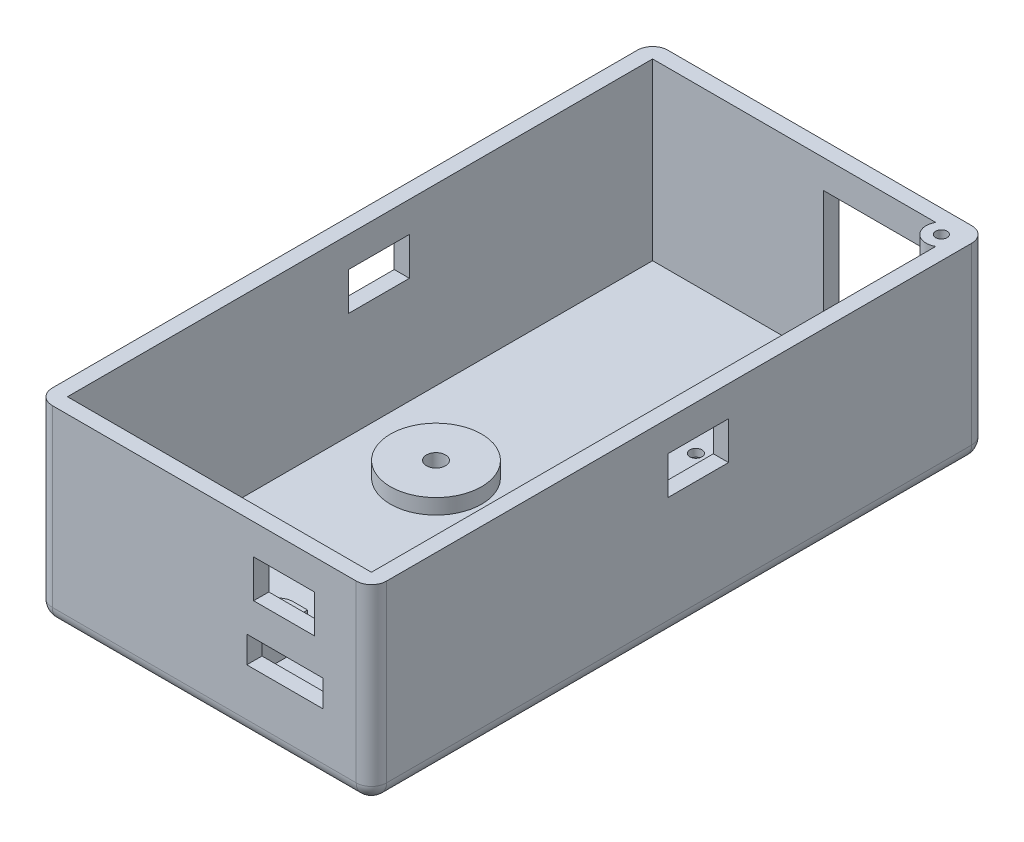
from build123d import *
from build123d.topology import SkipClean

# Parameters (mm, degrees)
SKETCH_1_W           = 44
SKETCH_1_H           = 81
EXTRUDE_1_DEPTH      = 25
SHELL_1_T            = -2
FILLET_1_R           = 2
SKETCH_2_R           = 0.8
SKETCH_2_R_2         = 0.9
CUT_EXTRUDE_1_DEPTH  = 24
SKETCH_3_R           = 1.25
CUT_EXTRUDE_2_DEPTH  = 24
SKETCH_4_R           = 6
EXTRUDE_2_DEPTH      = 2
CUT_EXTRUDE_START    = -13.2
SKETCH_6_R           = 1.25
CUT_EXTRUDE_4_DEPTH  = 13.2
SKETCH_7_W           = 15.5
SKETCH_7_H           = 17.5
CUT_EXTRUDE_5_DEPTH  = 13.2
SKETCH_9_W           = 18.8
SKETCH_9_H           = 6.5
SKETCH_9_R           = 0.9
EXTRUDE_3_DEPTH      = 8
SKETCH_11_W          = 11
SKETCH_11_H          = 6.5
CUT_EXTRUDE_6_DEPTH  = 4
SKETCH_12_W          = 10
SKETCH_12_H          = 3.5
CUT_EXTRUDE_7_DEPTH  = 4
FILLET_2_R           = 2
EXTRUDE_START        = -1
SKETCH_14_R          = 1.25
EXTRUDE_4_DEPTH      = 1
SKETCH_15_R          = 2
CUT_EXTRUDE_8_DEPTH  = 1
SKETCH_16_W          = 8
SKETCH_16_H          = 5
CUT_EXTRUDE_9_DEPTH  = 59
SKETCH_17_R          = 2
EXTRUDE_5_DEPTH      = 3
SKETCH_18_R          = 0.75
CUT_EXTRUDE_10_DEPTH = 3
FILLET_3_R           = 2
SKETCH_19_W          = 8
SKETCH_19_H          = 5
CUT_EXTRUDE_11_DEPTH = 3


with BuildPart() as part:
    # 草图1 → 凸台-拉伸1 (new body)
    with BuildSketch(Plane(origin=(0, 0, 0), x_dir=(1, 0, 0), z_dir=(0, 1, 0))):
        with Locations((0, -2.5)):
            Rectangle(SKETCH_1_W, SKETCH_1_H)
    extrude(amount=EXTRUDE_1_DEPTH)

    # 抽壳1
    shell_1_openings = [part.faces().sort_by_distance(p)[0] for p in [
        (0, 25, 2.5),
    ]]
    offset(amount=SHELL_1_T, openings=shell_1_openings, kind=Kind.INTERSECTION)

    # 圆角1
    fillet_1_edges = [part.edges().sort_by_distance(p)[0] for p in [
        (0, 0, -38),
        (22, 0, 2.5),
        (0, 0, 43),
        (-22, 0, 2.5),
        (-22, 12.5, -38),
        (22, 12.5, -38),
        (22, 12.5, 43),
        (-22, 12.5, 43),
    ]]
    fillet(fillet_1_edges, radius=FILLET_1_R)

    # 草图2 → 切除-拉伸1 (cut)
    with BuildSketch(Plane(origin=(0, 2, 0), x_dir=(1, 0, 0), z_dir=(0, 1, 0))):
        with Locations(Location((4.8, 16.9, 0), (0, 0, 270))):
            Circle(SKETCH_2_R)
        with Locations(Location((16.1, -9.5, 0), (0, 0, 270))):
            Circle(SKETCH_2_R_2)
    extrude(amount=-CUT_EXTRUDE_1_DEPTH, mode=Mode.SUBTRACT)

    # 草图3 → 切除-拉伸2 (cut)
    with BuildSketch(Plane(origin=(0, 2, 0), x_dir=(1, 0, 0), z_dir=(0, 1, 0))):
        with Locations(Location((-9.5, -3, 0), (0, 0, 270))):
            Circle(SKETCH_3_R)
    extrude(amount=-CUT_EXTRUDE_2_DEPTH, mode=Mode.SUBTRACT)

    # 草图4 → 凸台-拉伸2 (add)
    with BuildSketch(Plane(origin=(0, 2, 0), x_dir=(1, 0, 0), z_dir=(0, 1, 0))):
        with Locations(Location((-9.5, -3, 0), (0, 0, 270))):
            Circle(SKETCH_4_R)
    extrude(amount=EXTRUDE_2_DEPTH)

    # 草图6 → 切除-拉伸4 (cut)
    with BuildSketch(Plane.XZ.offset(CUT_EXTRUDE_START)):
        with Locations(Location((-9.5, 3, 0), (0, 0, 90))):
            Circle(SKETCH_6_R)
    extrude(amount=CUT_EXTRUDE_4_DEPTH, mode=Mode.SUBTRACT)

    # 草图7 → 切除-拉伸5 (cut)
    with BuildSketch(Plane(origin=(0, 0, -38), x_dir=(-1, 0, 0), z_dir=(0, 0, -1))):
        with Locations((-10.25, 12.5)):
            Rectangle(SKETCH_7_W, SKETCH_7_H)
    extrude(amount=-CUT_EXTRUDE_5_DEPTH, mode=Mode.SUBTRACT)

    # 草图9 → 凸台-拉伸3 (add)
    with BuildSketch(Plane(origin=(0, 2, 0), x_dir=(1, 0, 0), z_dir=(0, 1, 0))):
        with Locations((10.6, -37.75)):
            Rectangle(SKETCH_9_W, SKETCH_9_H)
        with Locations(Location((18.1, -37.9, 0), (0, 0, 270))):
            Circle(SKETCH_9_R, mode=Mode.SUBTRACT)
        with Locations(Location((3.1, -37.9, 0), (0, 0, 270))):
            Circle(SKETCH_9_R, mode=Mode.SUBTRACT)
    extrude(amount=EXTRUDE_3_DEPTH)

    # 草图11 → 切除-拉伸6 (cut)
    with BuildSketch(Plane(origin=(0, 10, 0), x_dir=(1, 0, 0), z_dir=(0, 1, 0))):
        with Locations((10.6, -37.75)):
            Rectangle(SKETCH_11_W, SKETCH_11_H)
    extrude(amount=-CUT_EXTRUDE_6_DEPTH, mode=Mode.SUBTRACT)

    # 草图12 → 切除-拉伸7 (cut)
    with BuildSketch(Plane.XY.offset(43)):
        with Locations((10.6, 10)):
            Rectangle(SKETCH_12_W, SKETCH_12_H)
    extrude(amount=-CUT_EXTRUDE_7_DEPTH, mode=Mode.SUBTRACT)

    # 圆角2
    fillet_2_edges = [part.edges().sort_by_distance(p)[0] for p in [
        (10.6, 2, 34.5),
        (1.2, 2, 37.75),
        (1.2, 6, 34.5),
    ]]
    fillet(fillet_2_edges, radius=FILLET_2_R)

    # 草图14 → 凸台-拉伸4 (add)
    with BuildSketch(Plane.XZ.offset(EXTRUDE_START)):
        with Locations(Location((-9.5, 3, 0), (0, 0, 90))):
            Circle(SKETCH_14_R)
    extrude(amount=EXTRUDE_4_DEPTH)

    # 草图15 → 切除-拉伸8 (cut)
    with BuildSketch(Plane.XZ):
        with Locations(Location((16.1, 9.5, 0), (0, 0, 270))):
            Circle(SKETCH_15_R)
        with Locations(Location((4.8, -16.9, 0), (0, 0, 270))):
            Circle(SKETCH_15_R)
    extrude(amount=-CUT_EXTRUDE_8_DEPTH, mode=Mode.SUBTRACT)

    # 草图16 → 切除-拉伸9 (cut)
    with BuildSketch(Plane.ZY.offset(22)):
        with Locations((0, 18.5)):
            Rectangle(SKETCH_16_W, SKETCH_16_H)
    extrude(amount=-CUT_EXTRUDE_9_DEPTH, mode=Mode.SUBTRACT)

    # 草图17 → 凸台-拉伸5 (add)
    with BuildSketch(Plane(origin=(0, 25, 0), x_dir=(1, 0, 0), z_dir=(0, 1, 0))):
        with Locations((19, 35)):
            Circle(SKETCH_17_R)
    extrude(amount=-EXTRUDE_5_DEPTH)

    # 草图18 → 切除-拉伸10 (cut)
    with BuildSketch(Plane(origin=(0, 25, 0), x_dir=(1, 0, 0), z_dir=(0, 1, 0))):
        with Locations(Location((19, 35, 0), (0, 0, 270))):
            Circle(SKETCH_18_R)
    extrude(amount=-CUT_EXTRUDE_10_DEPTH, mode=Mode.SUBTRACT)

    # 圆角3
    # the kernel refuses this fillet: 2 mm, written as the material it adds along each edge
    with BuildSketch(Plane(origin=(12.267949192, 22, -36), x_dir=(0, -1, 0), z_dir=(1, 0, 0))) as fillet_3_piece_1_section:
        with BuildLine():
            CenterArc((FILLET_3_R, -FILLET_3_R), FILLET_3_R, 90, 90)
            Line((0, -FILLET_3_R), (0, 0))
            Line((0, 0), (FILLET_3_R, 0))
        make_face()
    fillet_3_piece_1 = extrude(amount=7.732050808, mode=Mode.PRIVATE)
    fillet_3_piece_1 = fillet_3_piece_1 & Plane(origin=(19, 21.743486993, -35), x_dir=(1, 0, 0), z_dir=(0, 1, 0)) * Cylinder(2, 24, mode=Mode.PRIVATE)
    fillet_3_piece_1 = split(fillet_3_piece_1, bisect_by=Plane(origin=(18, 21.743486993, -35.418577815), z_dir=(-1, 0, 0)), keep=Keep.TOP, mode=Mode.PRIVATE)
    fillet_3_piece_1 = split(fillet_3_piece_1, bisect_by=Plane(origin=(17.546708028, 21.25, -35.418577815), z_dir=(0, 1, 0)), keep=Keep.TOP, mode=Mode.PRIVATE)
    add(fillet_3_piece_1)
    with BuildSketch(Plane(origin=(12.267949192, 22, -36), x_dir=(0, -1, 0), z_dir=(1, 0, 0))) as fillet_3_piece_2_section:
        with BuildLine():
            CenterArc((FILLET_3_R, -FILLET_3_R), FILLET_3_R, 90, 90)
            Line((0, -FILLET_3_R), (0, 0))
            Line((0, 0), (FILLET_3_R, 0))
        make_face()
    fillet_3_piece_2 = extrude(amount=7.732050808, mode=Mode.PRIVATE)
    fillet_3_piece_2 = split(fillet_3_piece_2, bisect_by=Plane(origin=(18, 20.864048259, -35.911747477), z_dir=(1, 0, 0)), keep=Keep.TOP, mode=Mode.PRIVATE)
    fillet_3_piece_2 = split(fillet_3_piece_2, bisect_by=Plane(origin=(18.99999999, 21.25, -35.911747477), z_dir=(0, -1, 0)), keep=Keep.TOP, mode=Mode.PRIVATE)
    fillet_3_piece_2 = fillet_3_piece_2 - Plane(origin=(19, 20.864048259, -35), x_dir=(0, 0, 1), z_dir=(0, 1, 0)) * Cylinder(0.75, 24, mode=Mode.PRIVATE)
    add(fillet_3_piece_2)
    with BuildSketch(Plane(origin=(12.267949192, 22, -36), x_dir=(0, -1, 0), z_dir=(1, 0, 0))) as fillet_3_piece_3_section:
        with BuildLine():
            CenterArc((FILLET_3_R, -FILLET_3_R), FILLET_3_R, 90, 90)
            Line((0, -FILLET_3_R), (0, 0))
            Line((0, 0), (FILLET_3_R, 0))
        make_face()
    fillet_3_piece_3 = extrude(amount=7.732050808, mode=Mode.PRIVATE)
    fillet_3_piece_3 = split(fillet_3_piece_3, bisect_by=Plane(origin=(18, 21.475531477, -35.364676357), z_dir=(1, 0, 0)), keep=Keep.TOP, mode=Mode.PRIVATE)
    fillet_3_piece_3 = split(fillet_3_piece_3, bisect_by=Plane(origin=(19.666666667, 21.25, -35.364676357), z_dir=(0, 1, 0)), keep=Keep.TOP, mode=Mode.PRIVATE)
    fillet_3_piece_3 = fillet_3_piece_3 - Plane(origin=(19, 21.475531477, -35), x_dir=(0, 0, 1), z_dir=(0, 1, 0)) * Cylinder(0.75, 24, mode=Mode.PRIVATE)
    add(fillet_3_piece_3)
    with BuildSketch(Plane(origin=(12.267949192, 22, -36), x_dir=(0, -1, 0), z_dir=(1, 0, 0))) as fillet_3_piece_4_section:
        with BuildLine():
            CenterArc((FILLET_3_R, -FILLET_3_R), FILLET_3_R, 90, 90)
            Line((0, -FILLET_3_R), (0, 0))
            Line((0, 0), (FILLET_3_R, 0))
        make_face()
    fillet_3_piece_4 = extrude(amount=12.732050808, mode=Mode.PRIVATE)
    fillet_3_piece_4 = split(fillet_3_piece_4, bisect_by=Plane(origin=(20, 20.885178509, -35.897350533), z_dir=(1, 0, 0)), keep=Keep.TOP, mode=Mode.PRIVATE)
    fillet_3_piece_4 = fillet_3_piece_4 & Plane(origin=(19, 20.885178509, -35), x_dir=(1, 0, 0), z_dir=(0, 1, 0)) * Cylinder(2, 34, mode=Mode.PRIVATE)
    fillet_3_piece_4 = split(fillet_3_piece_4, bisect_by=Plane(origin=(20.391607497, 21.25, -35.897350533), z_dir=(0, -1, 0)), keep=Keep.TOP, mode=Mode.PRIVATE)
    add(fillet_3_piece_4)
    with BuildSketch(Plane(origin=(12.267949192, 22, -36), x_dir=(0, -1, 0), z_dir=(1, 0, 0))) as fillet_3_piece_5_section:
        with BuildLine():
            CenterArc((FILLET_3_R, -FILLET_3_R), FILLET_3_R, 90, 90)
            Line((0, -FILLET_3_R), (0, 0))
            Line((0, 0), (FILLET_3_R, 0))
        make_face()
    fillet_3_piece_5 = extrude(amount=12.732050808, mode=Mode.PRIVATE)
    fillet_3_piece_5 = split(fillet_3_piece_5, bisect_by=Plane(origin=(20, 21.743487033, -35.418577693), z_dir=(1, 0, 0)), keep=Keep.TOP, mode=Mode.PRIVATE)
    fillet_3_piece_5 = fillet_3_piece_5 & Plane(origin=(19, 21.743487033, -35), x_dir=(1, 0, 0), z_dir=(0, 1, 0)) * Cylinder(2, 34, mode=Mode.PRIVATE)
    fillet_3_piece_5 = split(fillet_3_piece_5, bisect_by=Plane(origin=(20.45329205, 21.25, -35.418577693), z_dir=(0, 1, 0)), keep=Keep.TOP, mode=Mode.PRIVATE)
    add(fillet_3_piece_5)
    with BuildSketch(Plane(origin=(20, 22, -41), x_dir=(0, -1, 0), z_dir=(0, 0, 1))) as fillet_3_piece_6_section:
        with BuildLine():
            CenterArc((FILLET_3_R, -FILLET_3_R), FILLET_3_R, 90, 90)
            Line((0, -FILLET_3_R), (0, 0))
            Line((0, 0), (FILLET_3_R, 0))
        make_face()
    fillet_3_piece_6 = extrude(amount=12.732050808, mode=Mode.PRIVATE)
    fillet_3_piece_6 = fillet_3_piece_6 & Plane(origin=(19, 21.575046731, -35), x_dir=(1, 0, 0), z_dir=(0, 1, 0)) * Cylinder(2, 34, mode=Mode.PRIVATE)
    fillet_3_piece_6 = fillet_3_piece_6 - Plane(origin=(19, 21.575046731, -35), x_dir=(0, 0, 1), z_dir=(0, 1, 0)) * Cylinder(0.75, 34, mode=Mode.PRIVATE)
    add(fillet_3_piece_6)

    # 草图19 → 切除-拉伸11 (cut)
    with SkipClean():  # the faces are left unmerged after this step: merging them gives an invalid solid
        with BuildSketch(Plane.XY.offset(43)):
            with Locations((10.5, 18.5)):
                Rectangle(SKETCH_19_W, SKETCH_19_H)
        extrude(amount=-CUT_EXTRUDE_11_DEPTH, mode=Mode.SUBTRACT)


solid = part.part
